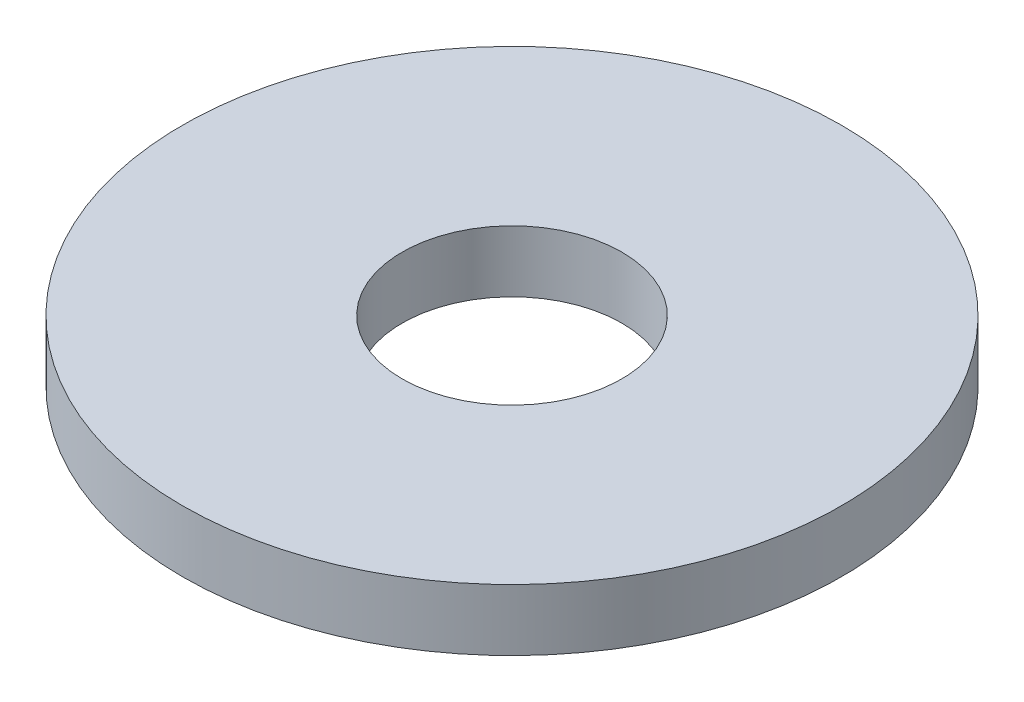
from build123d import *

# Parameters (mm, degrees)
SKETCH1_R           = 75
BOSS_EXTRUDE1_DEPTH = 14
SKETCH2_R           = 25
CUT_EXTRUDE1_DEPTH  = 107.98598039


with BuildPart() as part:
    # Sketch1 → Boss-Extrude1 (new body)
    with BuildSketch(Plane(origin=(0, 0, 0), x_dir=(1, 0, 0), z_dir=(0, 1, 0))):
        Circle(SKETCH1_R)
    extrude(amount=BOSS_EXTRUDE1_DEPTH)

    # Sketch2 → Cut-Extrude1 (cut, through all)
    with BuildSketch(Plane(origin=(0, 0, 0), x_dir=(1, 0, 0), z_dir=(0, 1, 0))):
        Circle(SKETCH2_R)
    extrude(amount=CUT_EXTRUDE1_DEPTH, mode=Mode.SUBTRACT)


solid = part.part
